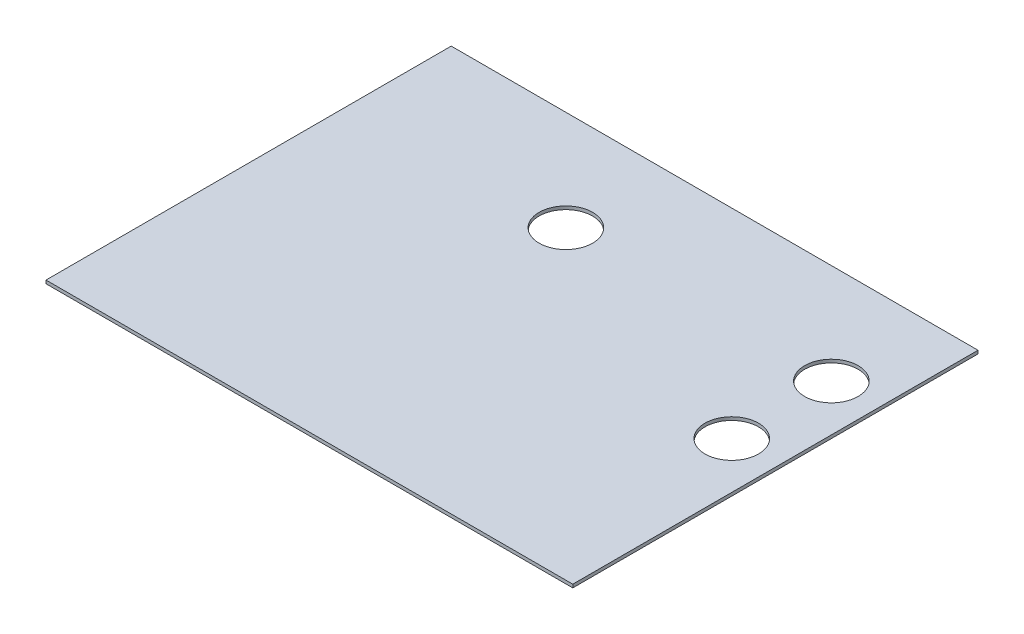
from build123d import *

# Parameters (mm, degrees)
SKETCH1_W           = 325
SKETCH1_H           = 250
BOSS_EXTRUDE1_DEPTH = 2
CUT_EXTRUDE1_REACH  = 207.025
SKETCH2_R           = 16.5


with BuildPart() as part:
    # Sketch1 → Boss-Extrude1 (new body)
    with BuildSketch(Plane(origin=(0, 0, 0), x_dir=(1, 0, 0), z_dir=(0, 1, 0))):
        Rectangle(SKETCH1_W, SKETCH1_H)
    extrude(amount=BOSS_EXTRUDE1_DEPTH)

    # Sketch2 → Cut-Extrude1 (cut, up to next)
    with BuildSketch(Plane(origin=(0, 2, 0), x_dir=(1, 0, 0), z_dir=(0, 1, 0)), mode=Mode.PRIVATE) as cut_extrude1_sk1:
        with Locations((133.736379862, 1.843557571)):
            Circle(SKETCH2_R)
    cut_extrude1_tool1 = extrude(cut_extrude1_sk1.sketch, amount=-CUT_EXTRUDE1_REACH, mode=Mode.PRIVATE) & part.part
    # Sketch2 → Cut-Extrude1 (cut, up to next)
    with BuildSketch(Plane(origin=(0, 2, 0), x_dir=(1, 0, 0), z_dir=(0, 1, 0)), mode=Mode.PRIVATE) as cut_extrude1_sk2:
        with Locations((133.736379862, 63.311910549)):
            Circle(SKETCH2_R)
    cut_extrude1_tool2 = extrude(cut_extrude1_sk2.sketch, amount=-CUT_EXTRUDE1_REACH, mode=Mode.PRIVATE) & part.part
    # Sketch2 → Cut-Extrude1 (cut, up to next)
    with BuildSketch(Plane(origin=(0, 2, 0), x_dir=(1, 0, 0), z_dir=(0, 1, 0)), mode=Mode.PRIVATE) as cut_extrude1_sk3:
        with Locations((-30.073468299, 63.311910549)):
            Circle(SKETCH2_R)
    cut_extrude1_tool3 = extrude(cut_extrude1_sk3.sketch, amount=-CUT_EXTRUDE1_REACH, mode=Mode.PRIVATE) & part.part
    add(cut_extrude1_tool1.solids().sort_by_distance((133.73638, 2, -1.843558))[0], mode=Mode.SUBTRACT)
    add(cut_extrude1_tool2.solids().sort_by_distance((133.73638, 2, -63.311911))[0], mode=Mode.SUBTRACT)
    add(cut_extrude1_tool3.solids().sort_by_distance((-30.073468, 2, -63.311911))[0], mode=Mode.SUBTRACT)


solid = part.part
